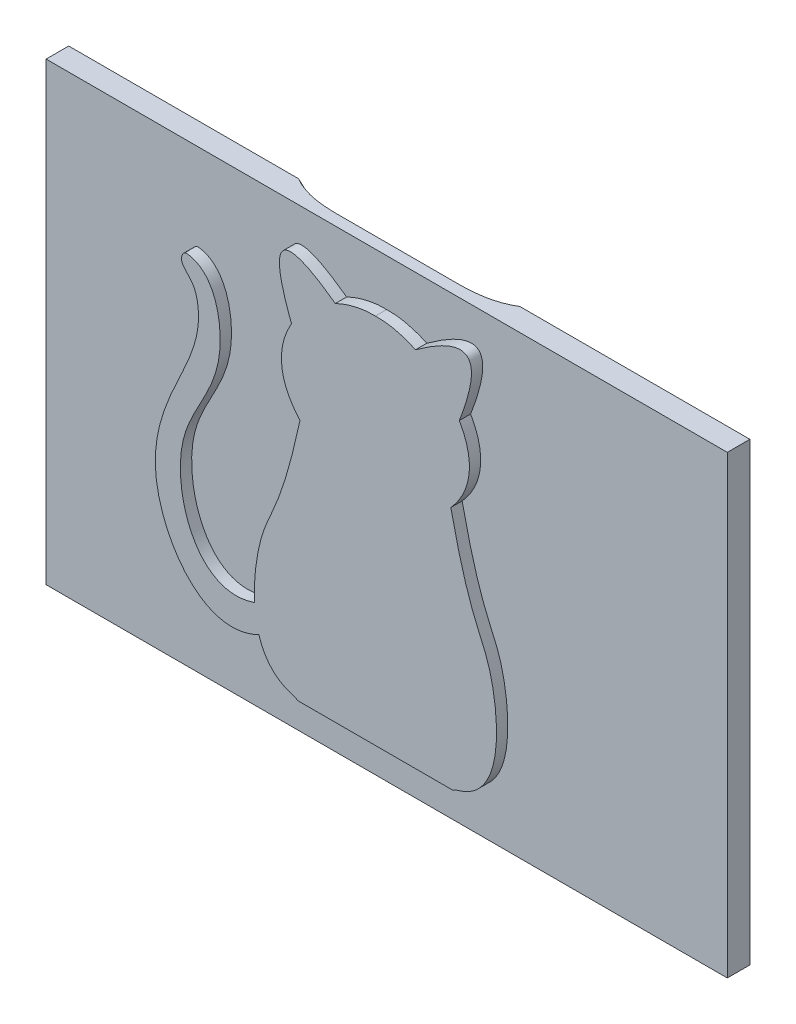
from build123d import *

# Parameters (mm, degrees)
MAINPLATE_DEPTH     = 2000
NOTCH_START         = 1000
NOTCH_DEPTH         = 1000
NOTCHFILLET_R       = 4000
BOSS_EXTRUDE1_DEPTH = 1000


with BuildPart() as part:
    # Sketch1 → MainPlate (new body)
    with BuildSketch(Plane.XY):
        with BuildLine():
            Line((-9797.958971133, 20150), (-30150, 20150))
            Line((-30150, 20150), (-30150, -20150))
            Line((-30150, -20150), (30150, -20150))
            Line((30150, -20150), (30150, 20150))
            Line((30150, 20150), (9797.958971133, 20150))
            ThreePointArc((9797.958971133, 20150), (0, 16150), (-9797.958971133, 20150))
        make_face()
    extrude(amount=MAINPLATE_DEPTH)

    # Sketch1<3> → Notch (add)
    with BuildSketch(Plane.XY.offset(NOTCH_START)):
        with BuildLine():
            Line((9797.958971133, 20150), (-9797.958971133, 20150))
            ThreePointArc((-9797.958971133, 20150), (0, 16150), (9797.958971133, 20150))
        make_face()
    extrude(amount=NOTCH_DEPTH)

    # NotchFillet
    # the kernel refuses this fillet: 4000 mm, written as the material it adds along each edge
    with BuildSketch(Plane(origin=(0, 30150, 1000), x_dir=(-0.9482993587700965, -0.3173772615614165, 0), z_dir=(-0.3173772615614165, 0.9482993587700965, 0))) as notchfillet_piece_1_section:
        with BuildLine():
            CenterArc((11354.248688935, -4000), NOTCHFILLET_R, 48.590377891, 41.409622109)
            Line((11354.248688935, 0), (11354.248688935, 80))
            Line((11354.248688935, 80), (14000, 80))
            Line((14000, 80), (14080, 0))
            ThreePointArc((14080, 0), (14080, -500), (14052.915026221, -940))
            Line((14052.915026221, -940), (14000, -1000))
        make_face()
    notchfillet_piece_1 = revolve(axis=Axis((0, 30150, 1000), (0, 0, 1)), revolution_arc=142.991226577, mode=Mode.PRIVATE)
    notchfillet_piece_1 = split(notchfillet_piece_1, bisect_by=Plane(origin=(0, 20150, 767.581558225), z_dir=(0, -1, 0)), keep=Keep.TOP, mode=Mode.PRIVATE)
    add(notchfillet_piece_1)

    # Sketch2 → Boss-Extrude1 (add)
    with BuildSketch(Plane.XY.offset(2000)):
        with BuildLine():
            add(Edge.make_bspline(
                [(-10701.415402451, -11295.099090351), (-15811.502818911, -13035.48604603), (-19505.298297344, -2003.070548065), (-12595.144077247, 4316.28380771), (-14193.330361108, 12218.868499182), (-17013.967280119, 12506.857365661), (-17294.09711996, 11747.511080652), (-16814.72253338, 11104.548568177), (-16001.341117572, 10377.595003792), (-15085.54328611, 6773.932209018), (-18212.203512754, 1514.956439448), (-21021.395070297, -7650.694259071), (-15118.803791461, -15967.321888991), (-10319.820482304, -13558.592370043)],
                knots=[0, 0, 0, 0, 0.209738333, 0.351877253, 0.464529447, 0.468874967, 0.481926302, 0.491092137, 0.50699965, 0.534380959, 0.661271137, 0.783505043, 1, 1, 1, 1], degree=3))
            add(Edge.make_bspline(
                [(-10701.415402451, -11295.099090351), (-10657.682935176, -12074.807448423), (-10540.914694203, -12847.81911371), (-10319.820482304, -13558.592370043)],
                knots=[0.712539323, 0.712539323, 0.712539323, 0.712539323, 0.801372914, 0.801372914, 0.801372914, 0.801372914], degree=3))
        make_face()
        with BuildLine():
            Line((0, -16899.973414605), (0, 16021.310496988))
            add(Edge.make_bspline(
                [(0, 16021.310496988), (-1184.841242541, 16054.065359953), (-2412.012387281, 15753.809481573), (-3548.122697587, 15210.200338564)],
                knots=[0, 0, 0, 0, 0.22628621, 0.22628621, 0.22628621, 0.22628621], degree=3))
            add(Edge.make_bspline(
                [(-3548.122697587, 15210.200338564), (-5144.389097299, 14446.414461707), (-6560.892058077, 13202.224248588), (-7427.649845507, 11726.309851782)],
                knots=[0.22628621, 0.22628621, 0.22628621, 0.22628621, 0.544224592, 0.544224592, 0.544224592, 0.544224592], degree=3))
            add(Edge.make_bspline(
                [(-7427.649845507, 11726.309851782), (-8670.176403991, 9610.536722684), (-8782.966148127, 7018.565977353), (-6676.075371015, 4682.994233731)],
                knots=[0.544224592, 0.544224592, 0.544224592, 0.544224592, 1, 1, 1, 1], degree=3))
            add(Edge.make_bspline(
                [(-6676.075371015, 4682.994233731), (-8517.118800664, -3858.031901679), (-9941.897389924, -3334.017600063), (-10790.987152988, -9698.119846038), (-10701.415402451, -11295.099090351)],
                knots=[0, 0, 0, 0, 0.530592574, 0.712539323, 0.712539323, 0.712539323, 0.712539323], degree=3))
            add(Edge.make_bspline(
                [(-10701.415402451, -11295.099090351), (-10657.682935176, -12074.807448423), (-10540.914694203, -12847.81911371), (-10319.820482304, -13558.592370043)],
                knots=[0.712539323, 0.712539323, 0.712539323, 0.712539323, 0.801372914, 0.801372914, 0.801372914, 0.801372914], degree=3))
            add(Edge.make_bspline(
                [(-10319.820482304, -13558.592370043), (-9871.552043124, -14999.684904718), (-8904.248206782, -16306.785010118), (-7098.201928611, -16739.734624268), (-6873.52996804, -16899.973414605)],
                knots=[0.801372914, 0.801372914, 0.801372914, 0.801372914, 0.981482989, 1, 1, 1, 1], degree=3))
            Line((-6873.52996804, -16899.973414605), (0, -16899.973414605))
        make_face()
        with BuildLine():
            add(Edge.make_bspline(
                [(0, 16021.310496988), (1184.841242541, 16054.065359953), (2412.012387281, 15753.809481573), (3548.122697587, 15210.200338564)],
                knots=[0, 0, 0, 0, 0.22628621, 0.22628621, 0.22628621, 0.22628621], degree=3))
            Line((0, 16021.310496988), (0, -16899.973414605))
            Line((0, -16899.973414605), (6873.52996804, -16899.973414605))
            add(Edge.make_bspline(
                [(6676.075371015, 4682.994233731), (8517.118800664, -3858.031901679), (10479.671466803, -3136.231565485), (11366.358658066, -15716.562166573), (7098.201928611, -16739.734624268), (6873.52996804, -16899.973414605)],
                knots=[0, 0, 0, 0, 0.530592574, 0.981482989, 1, 1, 1, 1], degree=3))
            add(Edge.make_bspline(
                [(7427.649845507, 11726.309851782), (8670.176403991, 9610.536722684), (8782.966148127, 7018.565977353), (6676.075371015, 4682.994233731)],
                knots=[0.544224592, 0.544224592, 0.544224592, 0.544224592, 1, 1, 1, 1], degree=3))
            add(Edge.make_bspline(
                [(3548.122697587, 15210.200338564), (5144.389097299, 14446.414461707), (6560.892058077, 13202.224248588), (7427.649845507, 11726.309851782)],
                knots=[0.22628621, 0.22628621, 0.22628621, 0.22628621, 0.544224592, 0.544224592, 0.544224592, 0.544224592], degree=3))
        make_face()
        with BuildLine():
            add(Edge.make_bspline(
                [(3548.122697587, 15210.200338564), (10798.626394755, 20491.68805006), (7427.649845507, 11726.309851782)],
                knots=[0, 0, 0, 1, 1, 1], degree=2))
            add(Edge.make_bspline(
                [(3548.122697587, 15210.200338564), (5144.389097299, 14446.414461707), (6560.892058077, 13202.224248588), (7427.649845507, 11726.309851782)],
                knots=[0.22628621, 0.22628621, 0.22628621, 0.22628621, 0.544224592, 0.544224592, 0.544224592, 0.544224592], degree=3))
        make_face()
        with BuildLine():
            add(Edge.make_bspline(
                [(-3548.122697587, 15210.200338564), (-5144.389097299, 14446.414461707), (-6560.892058077, 13202.224248588), (-7427.649845507, 11726.309851782)],
                knots=[0.22628621, 0.22628621, 0.22628621, 0.22628621, 0.544224592, 0.544224592, 0.544224592, 0.544224592], degree=3))
            add(Edge.make_bspline(
                [(-3548.122697587, 15210.200338564), (-10798.626394755, 20491.68805006), (-7427.649845507, 11726.309851782)],
                knots=[0, 0, 0, 1, 1, 1], degree=2))
        make_face()
    extrude(amount=BOSS_EXTRUDE1_DEPTH)


solid = part.part
